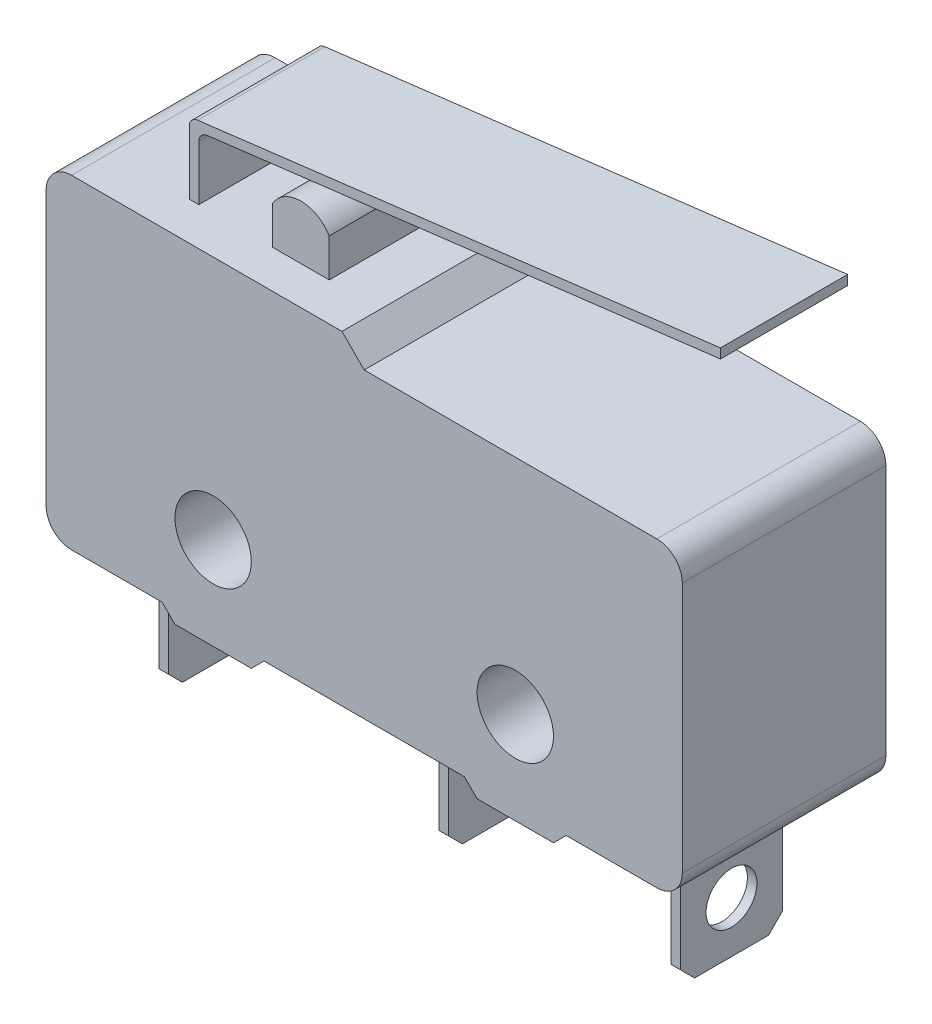
from build123d import *

# Parameters (mm, degrees)
SKETCH1_W           = 20
SKETCH1_H           = 10.2
BOSS_EXTRUDE1_DEPTH = 6.4
SKETCH2_W           = 0.3
SKETCH2_H           = 3.2
BOSS_EXTRUDE2_DEPTH = 3.9
CUT_EXTRUDE1_REACH  = 23.163
SKETCH3_R           = 0.8
LPATTERN1_COUNT     = 2
LPATTERN1_PITCH     = 8.8
LPATTERN2_COUNT     = 2
LPATTERN2_PITCH     = 16.1
SKETCH4_W           = 10
SKETCH4_H           = 6.4
CUT_EXTRUDE2_DEPTH  = 0.7
SKETCH5_R           = 1.2
CUT_EXTRUDE3_DEPTH  = 15.898322053
BOSS_EXTRUDE3_DEPTH = 6.4
CHAMFER1_SIZE       = 0.7
FILLET1_R           = 0.8
BOSS_EXTRUDE4_START = -1.2
BOSS_EXTRUDE4_DEPTH = 4
BOSS_EXTRUDE5_DEPTH = 4
FILLET2_R           = 0.3


with BuildPart() as part:
    # Sketch1 → Boss-Extrude1 (new body)
    with BuildSketch(Plane.XY):
        Rectangle(SKETCH1_W, SKETCH1_H)
    extrude(amount=BOSS_EXTRUDE1_DEPTH)

    # Sketch2 → Boss-Extrude2 (add)
    with BuildSketch(Plane.XZ.offset(5.1)):
        with Locations((-7.902688508, 3.2)):
            Rectangle(SKETCH2_W, SKETCH2_H)
    boss_extrude2 = extrude(amount=BOSS_EXTRUDE2_DEPTH)

    # Sketch3 → Cut-Extrude1 (cut, up to next)
    with BuildSketch(Plane.ZY.offset(8.052688508), mode=Mode.PRIVATE) as cut_extrude1_sk1:
        with Locations((3.2, -7.395440134)):
            Circle(SKETCH3_R)
    cut_extrude1_tool1 = extrude(cut_extrude1_sk1.sketch, amount=-CUT_EXTRUDE1_REACH, mode=Mode.PRIVATE) & part.part
    # Sketch3 → Cut-Extrude1 (cut, up to next)
    with BuildSketch(Plane.ZY.offset(8.052688508), mode=Mode.PRIVATE) as cut_extrude1_sk2:
        Polygon((4.362215953, -9), (4.8, -8.562215953), (4.8, -9), align=None)
    cut_extrude1_tool2 = extrude(cut_extrude1_sk2.sketch, amount=-CUT_EXTRUDE1_REACH, mode=Mode.PRIVATE) & part.part
    # Sketch3 → Cut-Extrude1 (cut, up to next)
    with BuildSketch(Plane.ZY.offset(8.052688508), mode=Mode.PRIVATE) as cut_extrude1_sk3:
        Polygon((2.037784047, -9), (1.6, -8.562215953), (1.6, -9), align=None)
    cut_extrude1_tool3 = extrude(cut_extrude1_sk3.sketch, amount=-CUT_EXTRUDE1_REACH, mode=Mode.PRIVATE) & part.part
    cut_extrude1_1 = cut_extrude1_tool1.solids().sort_by_distance((-8.052689, -7.39544, 3.2))[0]
    add(cut_extrude1_1, mode=Mode.SUBTRACT)
    cut_extrude1_2 = cut_extrude1_tool2.solids().sort_by_distance((-8.052689, -8.854072, 4.654072))[0]
    add(cut_extrude1_2, mode=Mode.SUBTRACT)
    cut_extrude1_3 = cut_extrude1_tool3.solids().sort_by_distance((-8.052689, -8.854072, 1.745928))[0]
    add(cut_extrude1_3, mode=Mode.SUBTRACT)
    cut_extrude1 = cut_extrude1_1 + cut_extrude1_2 + cut_extrude1_3  # Cut-Extrude1 as one shape, for the pattern or mirror that repeats it

    # LPattern1: Boss-Extrude2, Cut-Extrude1 ×2
    with Locations(*[(i * LPATTERN1_PITCH, 0, 0) for i in range(1, LPATTERN1_COUNT)]):
        add(boss_extrude2)
        add(cut_extrude1, mode=Mode.SUBTRACT)

    # LPattern2: Boss-Extrude2, Cut-Extrude1 ×2
    with Locations(*[(i * LPATTERN2_PITCH, 0, 0) for i in range(1, LPATTERN2_COUNT)]):
        add(boss_extrude2)
        add(cut_extrude1, mode=Mode.SUBTRACT)

    # Sketch4 → Cut-Extrude2 (cut)
    with BuildSketch(Plane(origin=(0, 5.1, 0), x_dir=(1, 0, 0), z_dir=(0, 1, 0))):
        with Locations((5, -3.2)):
            Rectangle(SKETCH4_W, SKETCH4_H)
    extrude(amount=-CUT_EXTRUDE2_DEPTH, mode=Mode.SUBTRACT)

    # Sketch5 → Cut-Extrude3 (cut, through all)
    with BuildSketch(Plane.XY.offset(6.4)):
        with Locations((-4.75, -2.6)):
            Circle(SKETCH5_R)
        with Locations((4.75, -2.6)):
            Circle(SKETCH5_R)
    extrude(amount=-CUT_EXTRUDE3_DEPTH, mode=Mode.SUBTRACT)

    # Sketch7 → Boss-Extrude3 (add)
    with BuildSketch(Plane.XY.offset(6.4)):
        Polygon((-3.55, -5.5), (-5.95, -5.5), (-6.35, -5.1), (-3.15, -5.1), align=None)
        Polygon((5.95, -5.5), (3.55, -5.5), (3.15, -5.1), (6.35, -5.1), align=None)
    extrude(amount=-BOSS_EXTRUDE3_DEPTH)

    # Chamfer1
    chamfer1_edges = [part.edges().sort_by_distance(p)[0] for p in [
        (0, 5.1, 3.2),
    ]]
    chamfer(chamfer1_edges, length=CHAMFER1_SIZE - 0.0001)  # a hair under: the kernel refuses the full size

    # Fillet1
    fillet1_edges = [part.edges().sort_by_distance(p)[0] for p in [
        (10, 4.4, 3.2),
        (10, -5.1, 3.2),
        (-10, -5.1, 3.2),
        (-10, 5.1, 3.2),
    ]]
    fillet(fillet1_edges, radius=FILLET1_R)

    # Sketch8 → Boss-Extrude4 (add)
    with BuildSketch(Plane.XY.offset(6.4).offset(BOSS_EXTRUDE4_START)):
        with BuildLine():
            Line((-2.300370524, 5.1), (-2.300370524, 6.3))
            ThreePointArc((-2.300370524, 6.3), (-3.188470104, 6.802852397), (-4.076569683, 6.3))
            Line((-4.076569683, 6.3), (-4.076569683, 5.1))
            Line((-4.076569683, 5.1), (-2.300370524, 5.1))
        make_face()
    extrude(amount=-BOSS_EXTRUDE4_DEPTH)

    # Sketch11 → Boss-Extrude5 (add)
    with BuildSketch(Plane.XY.offset(5.2)):
        Polygon((-6.4, 5.1), (-6.7, 5.1), (-6.7, 7.349497833), (10, 9.4), (10, 9.097747052), (-6.4, 7.084080254), align=None)
    extrude(amount=-BOSS_EXTRUDE5_DEPTH)

    # Fillet2
    fillet2_edges = [part.edges().sort_by_distance(p)[0] for p in [
        (-6.7, 7.349497833, 3.2),
        (-6.4, 7.084080254, 3.2),
    ]]
    fillet(fillet2_edges, radius=FILLET2_R)


solid = part.part
